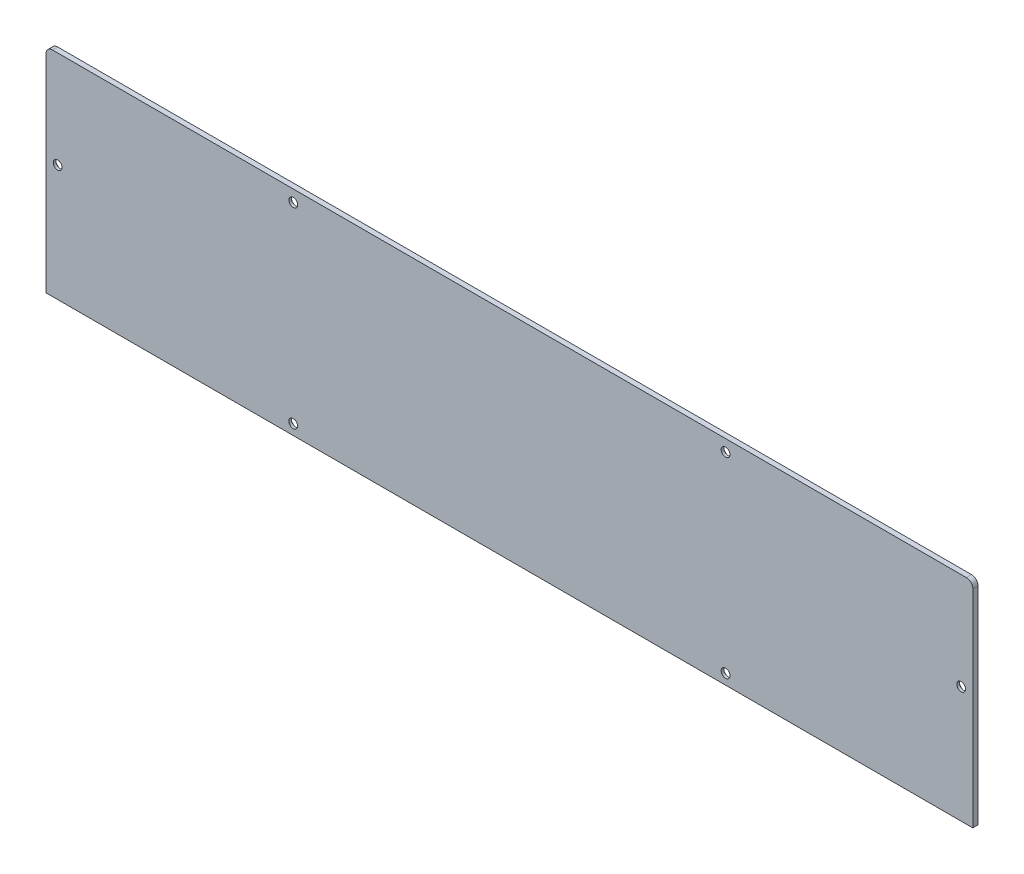
from build123d import *

# Parameters (mm, degrees)
EXTRUDE_1_DEPTH            = 2
HOLE_WIZARD_2_D            = 3.4
HOLE_WIZARD_2_DEPTH        = 7.5
HOLE_WIZARD_2_CBORE_D      = 6
HOLE_WIZARD_2_CBORE_DEPTH  = 1
HOLE_WIZARD_2_TIP          = 1.021463052
CUT_EXTRUDE_1_DEPTH        = 293.02858542
HOLE_WIZARD_2_2_AT_2_COUNT = 2
HOLE_WIZARD_2_2_AT_2_PITCH = 167


with BuildPart() as part:
    # 草图1 → 凸台-拉伸1 (new body)
    with BuildSketch(Plane(origin=(0, 0, 222.724508868), x_dir=(-1, 0, 0), z_dir=(0, 0, -1))):
        with BuildLine():
            Line((-76.251869293, -10), (282.750233779, -10))
            Line((282.750233779, -10), (282.750233779, 70))
            ThreePointArc((282.750233779, 70), (281.871554123, 72.121320344), (279.750233779, 73))
            Line((279.750233779, 73), (-73.251869293, 73))
            ThreePointArc((-73.251869293, 73), (-75.373189637, 72.121320344), (-76.251869293, 70))
            Line((-76.251869293, 70), (-76.251869293, -10))
        make_face()
    extrude(amount=EXTRUDE_1_DEPTH)

    # Hole Wizard 2
    with Locations(Plane(origin=(71.251869293, 35, 220.724508868), x_dir=(-1, 0, 0), z_dir=(0, 0, -1))):
        with Locations((0, 0), (91.001051536, 33), (258.001051536, 33), (349.002103072, 0)):
            CounterBoreHole(HOLE_WIZARD_2_D / 2, HOLE_WIZARD_2_CBORE_D / 2, HOLE_WIZARD_2_CBORE_DEPTH, depth=HOLE_WIZARD_2_DEPTH)
            with Locations((0, 0, -(HOLE_WIZARD_2_DEPTH + HOLE_WIZARD_2_TIP / 2))):  # 118° drill point
                Cone(0, HOLE_WIZARD_2_D / 2, HOLE_WIZARD_2_TIP, mode=Mode.SUBTRACT)

    # 草图4 → 切除-拉伸1 (cut, through all)
    with BuildSketch(Plane(origin=(0, 0, 220.724508868), x_dir=(-1, 0, 0), z_dir=(0, 0, -1))):
        with BuildLine():
            Line((-76.251869293, 70), (-76.251869293, -10))
            Line((-76.251869293, -10), (-75.751869293, -10))
            Line((-75.751869293, -10), (-75.751869293, 70))
            ThreePointArc((-75.751869293, 70), (-75.019636246, 71.767766953), (-73.251869293, 72.5))
            Line((-73.251869293, 72.5), (279.750233779, 72.5))
            ThreePointArc((279.750233779, 72.5), (281.518000732, 71.767766953), (282.250233779, 70))
            Line((282.250233779, 70), (282.250233779, -10))
            Line((282.250233779, -10), (282.750233779, -10))
            Line((282.750233779, -10), (282.750233779, 70))
            ThreePointArc((282.750233779, 70), (281.871554123, 72.121320344), (279.750233779, 73))
            Line((279.750233779, 73), (-73.251869293, 73))
            ThreePointArc((-73.251869293, 73), (-75.373189637, 72.121320344), (-76.251869293, 70))
        make_face()
    extrude(amount=-CUT_EXTRUDE_1_DEPTH, mode=Mode.SUBTRACT)

    # 草图5 → Hole Wizard 2 2 (revolve, cut)
    with BuildSketch(Plane(origin=(-19.749182243, -6, 220.724508868), x_dir=(0, 1, 0), z_dir=(1, 0, 0))):
        Polygon((0, 0), (0, 20.521463052), (1.7, 19.5), (1.7, 1), (3, 1), (3, 0), align=None)
    hole_wizard_2_2 = revolve(axis=Axis((-19.749182243, -6, 214.374508868), (0, 0, 1)), mode=Mode.SUBTRACT)

    # Hole Wizard 2 2 at 2: Hole Wizard 2 2 ×2
    with Locations(*[(-i * HOLE_WIZARD_2_2_AT_2_PITCH, 0, 0) for i in range(1, HOLE_WIZARD_2_2_AT_2_COUNT)]):
        add(hole_wizard_2_2, mode=Mode.SUBTRACT)


solid = part.part
